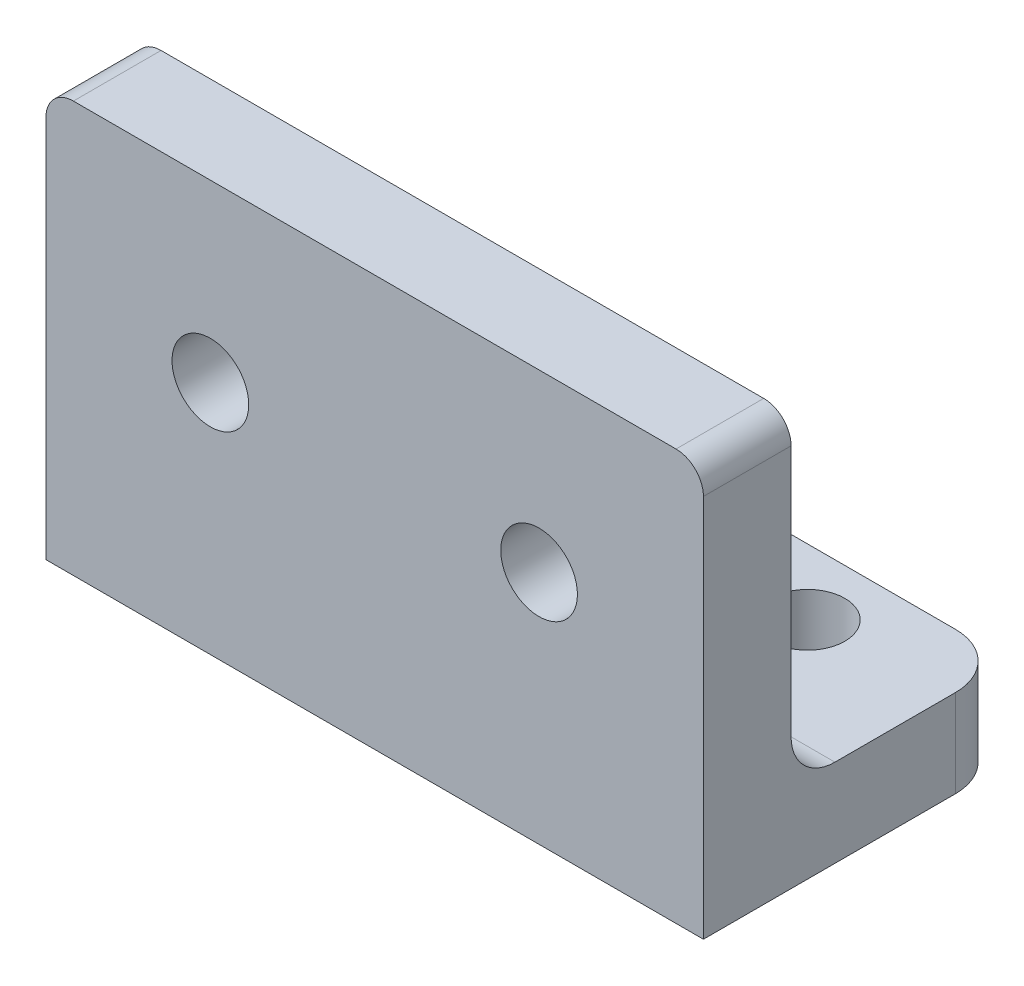
from build123d import *

# Parameters (mm, degrees)
SKETCH1_W                = 30
SKETCH1_H                = 18.75
BOSS_EXTRUDE1_DEPTH      = 4
FILLET1_R                = 1.25
SKETCH3_R                = 1.75
CUT_EXTRUDE1_DEPTH       = 10
SKETCH4_W                = 30
SKETCH4_H                = 4
BOSS_EXTRUDE2_DEPTH      = 10
FILLET2_R                = 2.5
FILLET3_R                = 2
M3_CLEARANCE_HOLE1_D     = 3.4
M3_CLEARANCE_HOLE1_DEPTH = 16
M3_CLEARANCE_HOLE1_TIP   = 1.021463052


with BuildPart() as part:
    # Sketch1 → Boss-Extrude1 (new body)
    with BuildSketch(Plane.XY):
        Rectangle(SKETCH1_W, SKETCH1_H)
    extrude(amount=BOSS_EXTRUDE1_DEPTH)

    # Fillet1
    fillet1_edges = [part.edges().sort_by_distance(p)[0] for p in [
        (15, 9.375, 2),
        (-15, 9.375, 2),
    ]]
    fillet(fillet1_edges, radius=FILLET1_R)

    # Sketch3 → Cut-Extrude1 (cut)
    with BuildSketch(Plane.XY.offset(4)):
        with Locations((-7.5, 1.375)):
            Circle(SKETCH3_R)
        with Locations((7.5, 1.375)):
            Circle(SKETCH3_R)
    extrude(amount=-CUT_EXTRUDE1_DEPTH, mode=Mode.SUBTRACT)

    # Sketch4 → Boss-Extrude2 (add)
    with BuildSketch(Plane(origin=(0, 0, 0), x_dir=(-1, 0, 0), z_dir=(0, 0, -1))):
        with Locations((0, -7.375)):
            Rectangle(SKETCH4_W, SKETCH4_H)
    extrude(amount=BOSS_EXTRUDE2_DEPTH)

    # Fillet2
    fillet2_edges = [part.edges().sort_by_distance(p)[0] for p in [
        (15, -7.375, -10),
        (-15, -7.375, -10),
    ]]
    fillet(fillet2_edges, radius=FILLET2_R)

    # Fillet3
    fillet3_edges = [part.edges().sort_by_distance(p)[0] for p in [
        (0, -5.375, 0),
    ]]
    fillet(fillet3_edges, radius=FILLET3_R)

    # M3 Clearance Hole1
    with Locations(Plane(origin=(0, -9.375, 0), x_dir=(-1, 0, 0), z_dir=(0, -1, 0))):
        with Locations((-8.75, 7), (8.75, 7)):
            Hole(M3_CLEARANCE_HOLE1_D / 2, depth=M3_CLEARANCE_HOLE1_DEPTH)
            with Locations((0, 0, -(M3_CLEARANCE_HOLE1_DEPTH + M3_CLEARANCE_HOLE1_TIP / 2))):  # 118° drill point
                Cone(0, M3_CLEARANCE_HOLE1_D / 2, M3_CLEARANCE_HOLE1_TIP, mode=Mode.SUBTRACT)


solid = part.part
